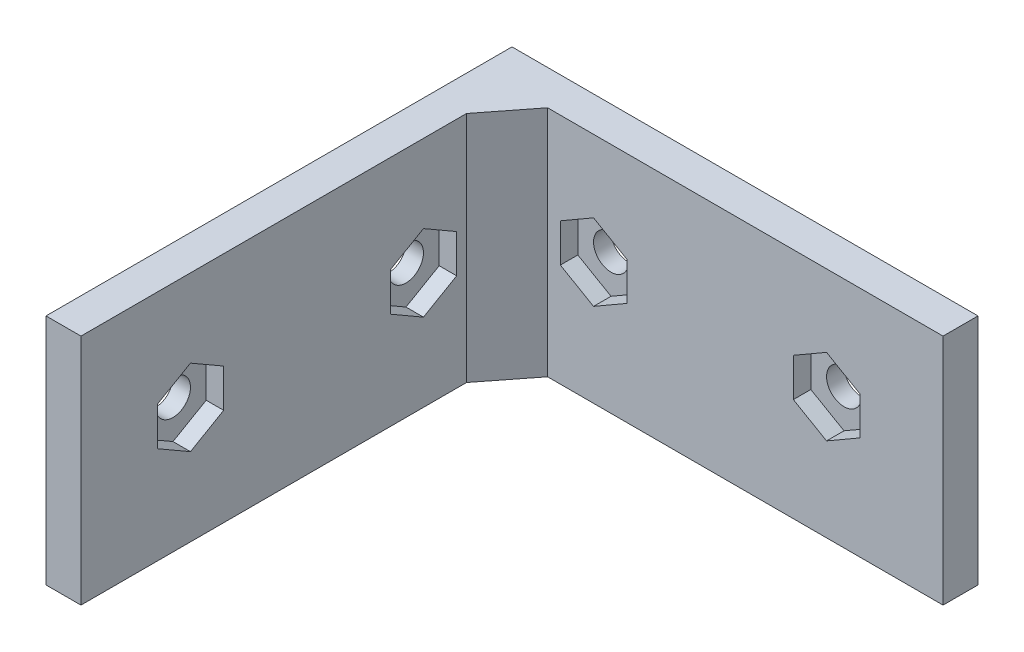
from build123d import *

# Parameters (mm, degrees)
ESQUISSE1_W             = 40
ESQUISSE1_H             = 20
BOSS_EXTRU_1_DEPTH      = 3
ESQUISSE2_R             = 1.5
ENL_V_MAT_EXTRU_1_DEPTH = 3
ESQUISSE3_W             = 3
ESQUISSE3_H             = 20
BOSS_EXTRU_2_DEPTH      = 37
ESQUISSE4_R             = 1.5
ENL_V_MAT_EXTRU_2_DEPTH = 3
ENL_V_MAT_EXTRU_3_DEPTH = 1.5
ENL_V_MAT_EXTRU_4_DEPTH = 1.5
BOSS_EXTRU_3_DEPTH      = 20


with BuildPart() as part:
    # Esquisse1 → Boss.-Extru.1 (new body)
    with BuildSketch(Plane.XY):
        with Locations((20, 10)):
            Rectangle(ESQUISSE1_W, ESQUISSE1_H)
    extrude(amount=BOSS_EXTRU_1_DEPTH)

    # Esquisse2 → Enlèv. mat.-Extru.1 (cut)
    with BuildSketch(Plane.XY.offset(3)):
        with Locations((10, 10.5)):
            Circle(ESQUISSE2_R)
        with Locations((30, 10.5)):
            Circle(ESQUISSE2_R)
    extrude(amount=-ENL_V_MAT_EXTRU_1_DEPTH, mode=Mode.SUBTRACT)

    # Esquisse3 → Boss.-Extru.2 (add)
    with BuildSketch(Plane.XY.offset(3)):
        with Locations((1.5, 10)):
            Rectangle(ESQUISSE3_W, ESQUISSE3_H)
    extrude(amount=BOSS_EXTRU_2_DEPTH)

    # Esquisse4 → Enlèv. mat.-Extru.2 (cut)
    with BuildSketch(Plane.ZY):
        with Locations((10.6, 10)):
            Circle(ESQUISSE4_R)
        with Locations((30.6, 10)):
            Circle(ESQUISSE4_R)
    extrude(amount=-ENL_V_MAT_EXTRU_2_DEPTH, mode=Mode.SUBTRACT)

    # Esquisse5 → Enlèv. mat.-Extru.3 (cut)
    with BuildSketch(Plane(origin=(3, 0, 0), x_dir=(0, 0, -1), z_dir=(1, 0, 0))):
        Polygon((-13.45, 8.354551733), (-10.6, 6.709103466), (-7.75, 8.354551733), (-7.75, 11.645448267), (-10.6, 13.290896534), (-13.45, 11.645448267), align=None)
        Polygon((-30.6, 6.709103466), (-27.75, 8.354551733), (-27.75, 11.645448267), (-30.6, 13.290896534), (-33.45, 11.645448267), (-33.45, 8.354551733), align=None)
    extrude(amount=-ENL_V_MAT_EXTRU_3_DEPTH, mode=Mode.SUBTRACT)

    # Esquisse6 → Enlèv. mat.-Extru.4 (cut)
    with BuildSketch(Plane.XY.offset(3)):
        Polygon((27.15, 8.854551733), (30, 7.209103466), (32.85, 8.854551733), (32.85, 12.145448267), (30, 13.790896534), (27.15, 12.145448267), align=None)
        Polygon((10, 7.209103466), (12.85, 8.854551733), (12.85, 12.145448267), (10, 13.790896534), (7.15, 12.145448267), (7.15, 8.854551733), align=None)
    extrude(amount=-ENL_V_MAT_EXTRU_4_DEPTH, mode=Mode.SUBTRACT)

    # Esquisse7 → Boss.-Extru.3 (add)
    with BuildSketch(Plane.XZ):
        Polygon((6.054442849, 3), (3, 6.904566912), (3, 3), align=None)
    extrude(amount=-BOSS_EXTRU_3_DEPTH)


solid = part.part
